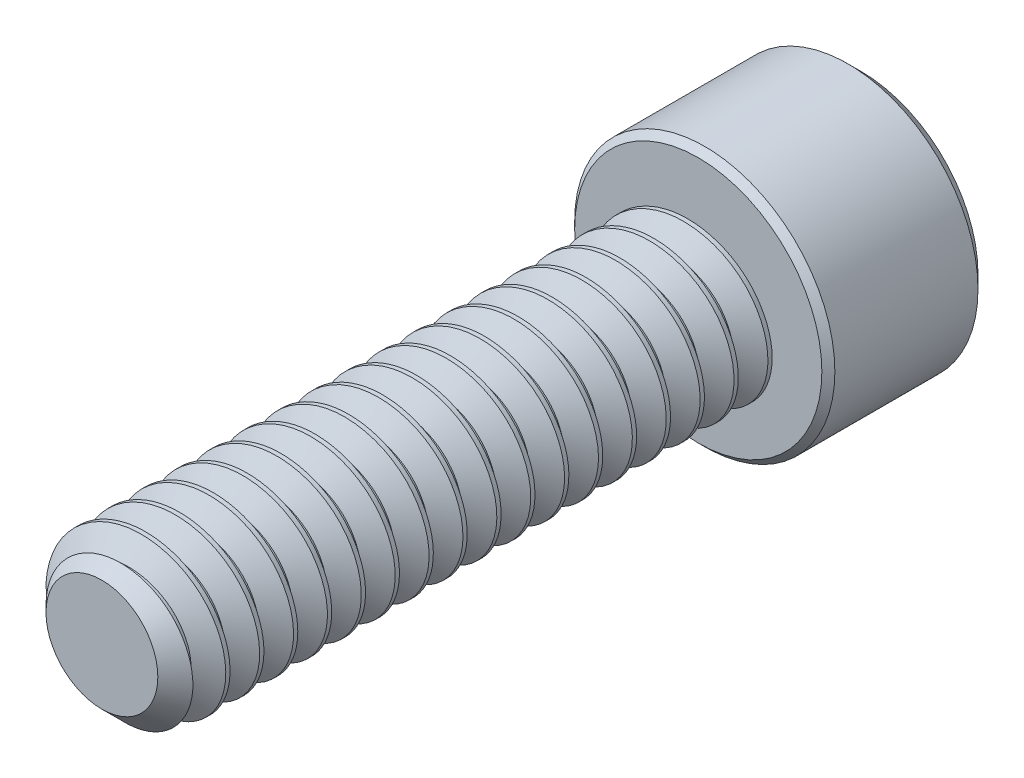
from build123d import *

# Parameters (mm, degrees)
SKETCH1_R          = 0.762
EXTRUDE1_DEPTH     = 5.588
CHAMFER3_SIZE      = 0.238125
CUT_SWEEP1_PITCH   = 0.3175
SKETCH6_R          = 1.2192
EXTRUDE2_DEPTH     = 1.524
CUT_EXTRUDE1_DEPTH = 0.9525
CHAMFER1_SIZE      = 0.12192
CHAMFER2_SIZE      = 0.06096


with BuildPart() as part:
    # Sketch1 → Extrude1 (new body)
    with BuildSketch(Plane.XY):
        Circle(SKETCH1_R)
    extrude(amount=-EXTRUDE1_DEPTH)

    # Chamfer3
    chamfer3_edges = [part.edges().sort_by_distance(p)[0] for p in [
        (-0.762, 0, 0),
    ]]
    chamfer(chamfer3_edges, length=CHAMFER3_SIZE)

    # Cut-Sweep1: the profile of Sketch3 profile screwed along a right-hand helix of 21 turns, 6 arcs to a turn; built about Z, then put on its axis
    cut_sweep1_z = Axis((0, 0, 0), (0, 0, 1))
    cut_sweep1_corners = [(0.7623, 0, -0.277985705), (0.555777701, 0, -0.15875), (0.555777701, 0, -0.1190625), (0.7623, 0, 0.000173205)]
    with BuildLine(mode=Mode.PRIVATE) as cut_sweep1_profile:
        Line(cut_sweep1_corners[0], cut_sweep1_corners[1])
        Line(cut_sweep1_corners[1], cut_sweep1_corners[2])
        Line(cut_sweep1_corners[2], cut_sweep1_corners[3])
        Line(cut_sweep1_corners[3], cut_sweep1_corners[0])
    cut_sweep1_cap = Face(cut_sweep1_profile.wire())
    cut_sweep1_turn_angles = [0, 30, 60, 90, 120, 150, 180, 210, 240, 270, 300, 330, 360]
    cut_sweep1_turn_weights = [1, 0.8660254037844387, 1, 0.8660254037844387, 1, 0.8660254037844387, 1, 0.8660254037844387, 1, 0.8660254037844387, 1, 0.8660254037844387, 1]
    cut_sweep1_turn_rails = [Edge.make_bspline([Vector(p[0], p[1], 0).rotate(cut_sweep1_z, cut_sweep1_turn_angles[k]) / cut_sweep1_turn_weights[k] + Vector(0, 0, p[2] + CUT_SWEEP1_PITCH * cut_sweep1_turn_angles[k] / 360) for k in range(13)], [0, 0, 0, 1, 1, 2, 2, 3, 3, 4, 4, 5, 5, 6, 6, 6], 2, cut_sweep1_turn_weights) for p in cut_sweep1_corners]
    cut_sweep1_turn_sides = [Face.make_surface_from_curves(cut_sweep1_turn_rails[p[0]], cut_sweep1_turn_rails[p[1]]) for p in [(0, 1), (1, 2), (2, 3), (3, 0)]]
    cut_sweep1 = Plane(origin=(0, 0, 0), x_dir=(0, 1, 0), z_dir=(0, 0, -1)) * Solid(Shell([*[p.moved(Location((0, 0, CUT_SWEEP1_PITCH * i))) for i in range(21) for p in cut_sweep1_turn_sides], cut_sweep1_cap, cut_sweep1_cap.rotate(cut_sweep1_z, 7560).moved(Location((0, 0, CUT_SWEEP1_PITCH * 7560 / 360)))]))
    add(cut_sweep1, mode=Mode.SUBTRACT)

    # Sketch6 → Extrude2 (add)
    with BuildSketch(Plane(origin=(0, 0, -5.588), x_dir=(-1, 0, 0), z_dir=(0, 0, -1))):
        with Locations(Location((0, 0, 0), (0, 0, 180))):
            Circle(SKETCH6_R)
    extrude(amount=EXTRUDE2_DEPTH)

    # Sketch7 → Cut-Extrude1 (cut)
    with BuildSketch(Plane(origin=(0, 0, -7.112), x_dir=(-1, 0, 0), z_dir=(0, 0, -1))):
        Polygon((0, 0.733234842), (-0.635, 0.366617421), (-0.635, -0.366617421), (0, -0.733234842), (0.635, -0.366617421), (0.635, 0.366617421), align=None)
    extrude(amount=-CUT_EXTRUDE1_DEPTH, mode=Mode.SUBTRACT)

    # Cut-Extrude2 cone 1 section (through the dimple's axis) → Cut-Extrude2 (revolve, cut)
    with BuildSketch(Plane(origin=(0, 0, -7.112), x_dir=(0, 1, 0), z_dir=(1, 0, 0))):
        Polygon((0, 0), (0.733234842, 0), (0, 0.733234842), align=None)
    revolve(axis=Axis((0, 0, -7.112), (0, 0, 1)), mode=Mode.SUBTRACT)

    # Chamfer1
    chamfer1_edges = [part.edges().sort_by_distance(p)[0] for p in [
        (-1.2192, 0, -7.112),
    ]]
    chamfer(chamfer1_edges, length=CHAMFER1_SIZE)

    # Chamfer2
    chamfer2_edges = [part.edges().sort_by_distance(p)[0] for p in [
        (-1.2192, 0, -5.588),
    ]]
    chamfer(chamfer2_edges, length=CHAMFER2_SIZE)


solid = part.part
